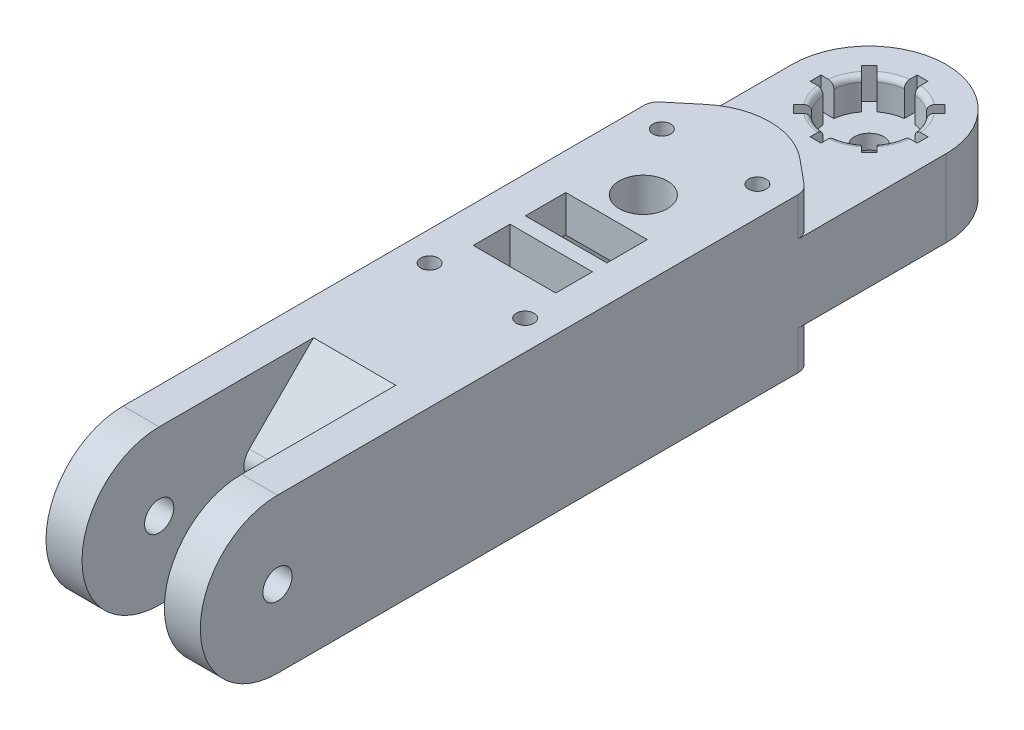
from build123d import *

# Parameters (mm, degrees)
SKETCH1_W                = 42
SKETCH1_H                = 42
BOSS_EXTRUDE1_DEPTH      = 140
SKETCH2_W                = 9.8
SKETCH2_H                = 42
BOSS_EXTRUDE2_DEPTH      = 21
BOSS_EXTRUDE4_DEPTH      = 9.8
BOSS_EXTRUDE5_START      = -9.8
BOSS_EXTRUDE5_DEPTH      = 9.8
SKETCH6_R                = 3.975
CUT_EXTRUDE1_DEPTH       = 187.015698262
SKETCH8_R                = 3.975
CUT_EXTRUDE2_DEPTH       = 187.015698262
SKETCH9_W                = 42
SKETCH9_H                = 21
BOSS_EXTRUDE6_DEPTH      = 21
BOSS_EXTRUDE7_DEPTH      = 21
SKETCH11_R               = 11.35
CUT_EXTRUDE3_DEPTH       = 8.5
CUT_EXTRUDE4_DEPTH       = 22.4
FILLET1_R                = 5
SKETCH18_R               = 11.1605
CUT_EXTRUDE5_DEPTH       = 8.5
SKETCH19_R               = 3.975
CUT_EXTRUDE6_DEPTH       = 8.5
FILLET4_R                = 1.5
FILLET5_R                = 1.5
SKETCH20_W               = 2.96
SKETCH20_H               = 3.81
CUT_EXTRUDE7_DEPTH       = 8.5
CIRPATTERN1_COUNT        = 8
MIRROR1_COPY_1_SKETCH_W  = 2.96
MIRROR1_COPY_1_SKETCH_H  = 3.81
MIRROR1_COPY_1_DEPTH     = 8.5
MIRROR1_COPY_2_SKETCH_W  = 2.96
MIRROR1_COPY_2_SKETCH_H  = 3.81
MIRROR1_COPY_2_DEPTH     = 8.5
MIRROR1_COPY_3_SKETCH_W  = 2.96
MIRROR1_COPY_3_SKETCH_H  = 3.81
MIRROR1_COPY_3_DEPTH     = 8.5
MIRROR1_COPY_4_SKETCH_W  = 2.96
MIRROR1_COPY_4_SKETCH_H  = 3.81
MIRROR1_COPY_4_DEPTH     = 8.5
MIRROR1_COPY_5_SKETCH_W  = 2.96
MIRROR1_COPY_5_SKETCH_H  = 3.81
MIRROR1_COPY_5_DEPTH     = 8.5
MIRROR1_COPY_6_SKETCH_W  = 2.96
MIRROR1_COPY_6_SKETCH_H  = 3.81
MIRROR1_COPY_6_DEPTH     = 8.5
MIRROR1_COPY_7_SKETCH_W  = 2.96
MIRROR1_COPY_7_SKETCH_H  = 3.81
MIRROR1_COPY_7_DEPTH     = 8.5
MIRROR1_COPY_8_SKETCH_W  = 2.96
MIRROR1_COPY_8_SKETCH_H  = 3.81
MIRROR1_COPY_8_DEPTH     = 8.5
SKETCH25_W               = 34
SKETCH25_H               = 49
CUT_EXTRUDE11_DEPTH      = 32
SKETCH26_W               = 34
SKETCH26_H               = 11.1
CUT_EXTRUDE12_DEPTH      = 27
SKETCH30_R               = 2.4
CUT_EXTRUDE13_DEPTH      = 186.186392589
FILLET10_R               = 3
MIRROR12_COPY_1_SKETCH_R = 2.4
MIRROR12_COPY_1_DEPTH    = 186.186392589
FILLET10_OF_MIRROR12_R   = 3
CUT_EXTRUDE16_DEPTH      = 10.5
FILLET12_R               = 20
FILLET12_OF_MIRROR13_R   = 20
FILLET13_R               = 4
SKETCH33_R               = 6.56
SKETCH33_W               = 22.45
SKETCH33_H               = 10
SKETCH33_W_2             = 22.2
SKETCH33_H_2             = 11
CUT_EXTRUDE17_DEPTH      = 186.981181844


with BuildPart() as part:
    # Sketch1 → Boss-Extrude1 (new body)
    with BuildSketch(Plane.XY):
        Rectangle(SKETCH1_W, SKETCH1_H)
    extrude(amount=BOSS_EXTRUDE1_DEPTH)

    # Sketch2 → Boss-Extrude2 (add)
    with BuildSketch(Plane.XY.offset(140)):
        with Locations((-16.1, 0)):
            Rectangle(SKETCH2_W, SKETCH2_H)
        with Locations((16.1, 0)):
            Rectangle(SKETCH2_W, SKETCH2_H)
    extrude(amount=BOSS_EXTRUDE2_DEPTH)

    # Sketch5 → Boss-Extrude4 (add)
    with BuildSketch(Plane.ZY.offset(-11.2)):
        with BuildLine():
            ThreePointArc((161, -21), (182, 0), (161, 21))
            Line((161, 21), (161, -21))
        make_face()
    extrude(amount=-BOSS_EXTRUDE4_DEPTH)

    # Sketch3 → Boss-Extrude5 (add)
    with BuildSketch(Plane(origin=(-11.2, 0, 0), x_dir=(0, 0, -1), z_dir=(1, 0, 0)).offset(BOSS_EXTRUDE5_START)):
        with BuildLine():
            Line((-161, -21), (-161, 21))
            ThreePointArc((-161, 21), (-182, 0), (-161, -21))
        make_face()
    extrude(amount=BOSS_EXTRUDE5_DEPTH)

    # Sketch6 → Cut-Extrude1 (cut, through all)
    with BuildSketch(Plane.ZY.offset(-11.2)):
        with Locations((161, 0)):
            Circle(SKETCH6_R)
    extrude(amount=-CUT_EXTRUDE1_DEPTH, mode=Mode.SUBTRACT)

    # Sketch8 → Cut-Extrude2 (cut, through all)
    with BuildSketch(Plane(origin=(-11.2, 0, 0), x_dir=(0, 0, -1), z_dir=(1, 0, 0))):
        with Locations((-161, 0)):
            Circle(SKETCH8_R)
    extrude(amount=-CUT_EXTRUDE2_DEPTH, mode=Mode.SUBTRACT)

    # Sketch9 → Boss-Extrude6 (add)
    with BuildSketch(Plane(origin=(0, 0, 0), x_dir=(-1, 0, 0), z_dir=(0, 0, -1))):
        Rectangle(SKETCH9_W, SKETCH9_H)
    extrude(amount=BOSS_EXTRUDE6_DEPTH)

    # Sketch10 → Boss-Extrude7 (add)
    with BuildSketch(Plane(origin=(0, -10.5, 0), x_dir=(-1, 0, 0), z_dir=(0, -1, 0))):
        with BuildLine():
            Line((-21, 21), (21, 21))
            ThreePointArc((21, 21), (0, 42), (-21, 21))
        make_face()
    extrude(amount=-BOSS_EXTRUDE7_DEPTH)

    # Sketch11 → Cut-Extrude3 (cut)
    with BuildSketch(Plane(origin=(0, -10.5, 0), x_dir=(-1, 0, 0), z_dir=(0, -1, 0))):
        with Locations((0, 21)):
            Circle(SKETCH11_R)
    extrude(amount=-CUT_EXTRUDE3_DEPTH, mode=Mode.SUBTRACT)

    # Sketch16 → Cut-Extrude4 (cut)
    with BuildSketch(Plane.ZY.offset(-11.2)):
        Polygon((140, -21), (140, 0), (119, -21), align=None)
        Polygon((140, 0), (140, 21), (119, 21), align=None)
    extrude(amount=CUT_EXTRUDE4_DEPTH, mode=Mode.SUBTRACT)

    # Fillet1
    fillet1_edges = [part.edges().sort_by_distance(p)[0] for p in [
        (0, 0, 140),
    ]]
    fillet(fillet1_edges, radius=FILLET1_R)

    # Sketch18 → Cut-Extrude5 (cut)
    with BuildSketch(Plane(origin=(0, 10.5, 0), x_dir=(1, 0, 0), z_dir=(0, 1, 0))):
        with Locations((0, 21)):
            Circle(SKETCH18_R)
    extrude(amount=-CUT_EXTRUDE5_DEPTH, mode=Mode.SUBTRACT)

    # Sketch19 → Cut-Extrude6 (cut)
    with BuildSketch(Plane.XZ.offset(2)):
        with Locations((0, -21)):
            Circle(SKETCH19_R)
    extrude(amount=-CUT_EXTRUDE6_DEPTH, mode=Mode.SUBTRACT)

    # Fillet4
    fillet4_edges = [part.edges().sort_by_distance(p)[0] for p in [
        (11.35, -10.5, -21),
    ]]
    fillet(fillet4_edges, radius=FILLET4_R)

    # Fillet5
    fillet5_edges = [part.edges().sort_by_distance(p)[0] for p in [
        (-11.1605, 10.5, -21),
    ]]
    fillet(fillet5_edges, radius=FILLET5_R)

    # Sketch20 → Cut-Extrude7 (cut)
    with BuildSketch(Plane(origin=(0, 10.5, 0), x_dir=(1, 0, 0), z_dir=(0, 1, 0))):
        with Locations((0, 33.6605)):
            Rectangle(SKETCH20_W, SKETCH20_H)
    cut_extrude7 = extrude(amount=-CUT_EXTRUDE7_DEPTH, mode=Mode.SUBTRACT)

    # CirPattern1: Cut-Extrude7 ×8 about axis
    cirpattern1_axis = Axis((0, 2, -21), (0, 1, 0))
    for i in range(1, CIRPATTERN1_COUNT):
        add(cut_extrude7.rotate(cirpattern1_axis, i * 360 / CIRPATTERN1_COUNT), mode=Mode.SUBTRACT)

    # Mirror1 copy 1 sketch → Mirror1 copy 1 (cut)
    with BuildSketch(Plane(origin=(14.849242405, -10.5, -6.150757595), x_dir=(0.7071067811865476, 0, -0.7071067811865475), z_dir=(0, -1, 0))):
        with Locations((0, -33.6605)):
            Rectangle(MIRROR1_COPY_1_SKETCH_W, MIRROR1_COPY_1_SKETCH_H)
    extrude(amount=-MIRROR1_COPY_1_DEPTH, mode=Mode.SUBTRACT)

    # Mirror1 copy 2 sketch → Mirror1 copy 2 (cut)
    with BuildSketch(Plane(origin=(21, -10.5, -21), x_dir=(0, 0, -1), z_dir=(0, -1, 0))):
        with Locations((0, -33.6605)):
            Rectangle(MIRROR1_COPY_2_SKETCH_W, MIRROR1_COPY_2_SKETCH_H)
    extrude(amount=-MIRROR1_COPY_2_DEPTH, mode=Mode.SUBTRACT)

    # Mirror1 copy 3 sketch → Mirror1 copy 3 (cut)
    with BuildSketch(Plane(origin=(14.849242405, -10.5, -35.849242405), x_dir=(-0.7071067811865475, 0, -0.7071067811865476), z_dir=(0, -1, 0))):
        with Locations((0, -33.6605)):
            Rectangle(MIRROR1_COPY_3_SKETCH_W, MIRROR1_COPY_3_SKETCH_H)
    extrude(amount=-MIRROR1_COPY_3_DEPTH, mode=Mode.SUBTRACT)

    # Mirror1 copy 4 sketch → Mirror1 copy 4 (cut)
    with BuildSketch(Plane(origin=(0, -10.5, -42), x_dir=(-1, 0, 0), z_dir=(0, -1, 0))):
        with Locations((0, -33.6605)):
            Rectangle(MIRROR1_COPY_4_SKETCH_W, MIRROR1_COPY_4_SKETCH_H)
    extrude(amount=-MIRROR1_COPY_4_DEPTH, mode=Mode.SUBTRACT)

    # Mirror1 copy 5 sketch → Mirror1 copy 5 (cut)
    with BuildSketch(Plane(origin=(-14.849242405, -10.5, -35.849242405), x_dir=(-0.7071067811865477, 0, 0.7071067811865475), z_dir=(0, -1, 0))):
        with Locations((0, -33.6605)):
            Rectangle(MIRROR1_COPY_5_SKETCH_W, MIRROR1_COPY_5_SKETCH_H)
    extrude(amount=-MIRROR1_COPY_5_DEPTH, mode=Mode.SUBTRACT)

    # Mirror1 copy 6 sketch → Mirror1 copy 6 (cut)
    with BuildSketch(Plane(origin=(-21, -10.5, -21), x_dir=(0, 0, 1), z_dir=(0, -1, 0))):
        with Locations((0, -33.6605)):
            Rectangle(MIRROR1_COPY_6_SKETCH_W, MIRROR1_COPY_6_SKETCH_H)
    extrude(amount=-MIRROR1_COPY_6_DEPTH, mode=Mode.SUBTRACT)

    # Mirror1 copy 7 sketch → Mirror1 copy 7 (cut)
    with BuildSketch(Plane(origin=(-14.849242405, -10.5, -6.150757595), x_dir=(0.7071067811865474, 0, 0.7071067811865477), z_dir=(0, -1, 0))):
        with Locations((0, -33.6605)):
            Rectangle(MIRROR1_COPY_7_SKETCH_W, MIRROR1_COPY_7_SKETCH_H)
    extrude(amount=-MIRROR1_COPY_7_DEPTH, mode=Mode.SUBTRACT)

    # Mirror1 copy 8 sketch → Mirror1 copy 8 (cut)
    with BuildSketch(Plane.XZ.offset(10.5)):
        with Locations((0, -33.6605)):
            Rectangle(MIRROR1_COPY_8_SKETCH_W, MIRROR1_COPY_8_SKETCH_H)
    extrude(amount=-MIRROR1_COPY_8_DEPTH, mode=Mode.SUBTRACT)

    # Sketch25 → Cut-Extrude11 (cut)
    with BuildSketch(Plane.XZ.offset(21)):
        with Locations((0, 54)):
            Rectangle(SKETCH25_W, SKETCH25_H)
    extrude(amount=-CUT_EXTRUDE11_DEPTH, mode=Mode.SUBTRACT)

    # Sketch26 → Cut-Extrude12 (cut)
    with BuildSketch(Plane.XZ.offset(21)):
        with Locations((0, 23.95)):
            Rectangle(SKETCH26_W, SKETCH26_H)
    cut_extrude12 = extrude(amount=-CUT_EXTRUDE12_DEPTH, mode=Mode.SUBTRACT)

    # Sketch30 → Cut-Extrude13 (cut, through all)
    with BuildSketch(Plane.XZ.offset(-6)):
        with Locations((-13, 22.4)):
            Circle(SKETCH30_R)
    cut_extrude13 = extrude(amount=-CUT_EXTRUDE13_DEPTH, mode=Mode.SUBTRACT)

    # Mirror9: Cut-Extrude13 across plane
    add(cut_extrude13.mirror(Plane.ZY), mode=Mode.SUBTRACT)

    # Fillet10
    fillet10_edges = [part.edges().sort_by_distance(p)[0] for p in [
        (-17, -7.5, 18.4),
        (17, -7.5, 18.4),
    ]]
    fillet(fillet10_edges, radius=FILLET10_R)

    # Mirror12: Cut-Extrude12, Cut-Extrude13 across plane
    add(cut_extrude12.mirror(Plane(origin=(0, 0, 54), x_dir=(1, 0, 0), z_dir=(0, 0, -1))), mode=Mode.SUBTRACT)
    add(cut_extrude13.mirror(Plane(origin=(0, 0, 54), x_dir=(1, 0, 0), z_dir=(0, 0, -1))), mode=Mode.SUBTRACT)

    # Mirror12 copy 1 sketch → Mirror12 copy 1 (cut, through all)
    with BuildSketch(Plane(origin=(0, 6, 108), x_dir=(-1, 0, 0), z_dir=(0, -1, 0))):
        with Locations((-13, 22.4)):
            Circle(MIRROR12_COPY_1_SKETCH_R)
    extrude(amount=-MIRROR12_COPY_1_DEPTH, mode=Mode.SUBTRACT)

    # Fillet10 of Mirror12
    fillet10_of_mirror12_edges = [part.edges().sort_by_distance(p)[0] for p in [
        (-17, -7.5, 89.6),
        (17, -7.5, 89.6),
    ]]
    fillet(fillet10_of_mirror12_edges, radius=FILLET10_OF_MIRROR12_R)

    # Sketch32 → Cut-Extrude16 (cut)
    with BuildSketch(Plane(origin=(0, 21, 0), x_dir=(1, 0, 0), z_dir=(0, 1, 0))):
        Polygon((21, 0), (0, 0), (21, -17.421516408), align=None)
        Polygon((-21, -17.421516408), (0, 0), (-21, 0), align=None)
    cut_extrude16 = extrude(amount=-CUT_EXTRUDE16_DEPTH, mode=Mode.SUBTRACT)

    # Fillet12
    fillet12_edges = [part.edges().sort_by_distance(p)[0] for p in [
        (0, 15.75, 0),
    ]]
    fillet(fillet12_edges, radius=FILLET12_R)

    # Mirror13: Cut-Extrude16 across plane
    add(cut_extrude16.mirror(Plane.ZX), mode=Mode.SUBTRACT)

    # Fillet12 of Mirror13
    fillet12_of_mirror13_edges = [part.edges().sort_by_distance(p)[0] for p in [
        (0, -15.75, 0),
    ]]
    fillet(fillet12_of_mirror13_edges, radius=FILLET12_OF_MIRROR13_R)

    # Fillet13
    fillet13_edges = [part.edges().sort_by_distance(p)[0] for p in [
        (-21, 15.75, 17.421516408),
        (-21, -15.75, 17.421516408),
        (21, -15.75, 17.421516408),
        (21, 15.75, 17.421516408),
    ]]
    fillet(fillet13_edges, radius=FILLET13_R)

    # Sketch33 → Cut-Extrude17 (cut, through all)
    with BuildSketch(Plane.XZ.offset(-11)):
        with Locations((0, 40.44)):
            Circle(SKETCH33_R)
        with Locations((0, 70.5)):
            Rectangle(SKETCH33_W, SKETCH33_H)
        with Locations((0, 55.94)):
            Rectangle(SKETCH33_W_2, SKETCH33_H_2)
    extrude(amount=-CUT_EXTRUDE17_DEPTH, mode=Mode.SUBTRACT)


solid = part.part
